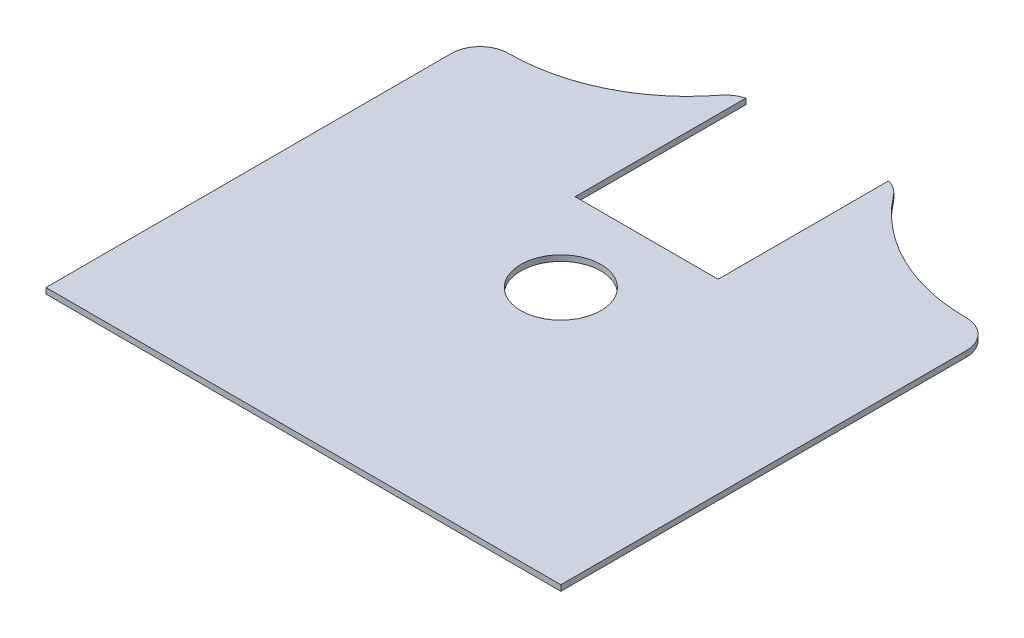
from build123d import *

# Parameters (mm, degrees)
SKETCH1_W           = 180
SKETCH1_H           = 180
BOSS_EXTRUDE1_DEPTH = 2
SKETCH2_R           = 14
CUT_EXTRUDE1_DEPTH  = 2
SKETCH4_W           = 50
SKETCH4_H           = 60
CUT_EXTRUDE2_DEPTH  = 2


with BuildPart() as part:
    # Sketch1 → Boss-Extrude1 (new body)
    with BuildSketch(Plane(origin=(0, 0, 0), x_dir=(1, 0, 0), z_dir=(0, 1, 0))):
        Rectangle(SKETCH1_W, SKETCH1_H)
    extrude(amount=BOSS_EXTRUDE1_DEPTH)

    # Sketch2 → Cut-Extrude1 (cut)
    with BuildSketch(Plane(origin=(0, 2, 0), x_dir=(-1, 0, 0), z_dir=(0, 1, 0))):
        Circle(SKETCH2_R)
        with BuildLine():
            Line((-22.28331281, -90), (-90, -90))
            Line((-90, -90), (-90, -51.741755227))
            ThreePointArc((-90, -51.741755227), (-87.062465996, -58.821414404), (-79.975685188, -61.741725666))
            ThreePointArc((-79.975685188, -61.741725666), (-52.247626752, -68.129791608), (-30.196860935, -86.113571466))
            ThreePointArc((-30.196860935, -86.113571466), (-26.691503217, -88.975959967), (-22.28331281, -90))
        make_face()
        with BuildLine():
            Line((90, -51.741726259), (90, -90))
            Line((90, -90), (22.435206222, -90))
            ThreePointArc((22.435206222, -90), (26.843382461, -88.975966926), (30.348735046, -86.11359645))
            ThreePointArc((30.348735046, -86.11359645), (52.340708927, -68.158736597), (79.996556017, -61.741725666))
            ThreePointArc((79.996556017, -61.741725666), (87.069850075, -58.814011598), (90, -51.741726259))
        make_face()
    extrude(amount=-CUT_EXTRUDE1_DEPTH, mode=Mode.SUBTRACT)

    # Sketch4 → Cut-Extrude2 (cut)
    with BuildSketch(Plane(origin=(0, 2, 0), x_dir=(1, 0, 0), z_dir=(0, 1, 0))):
        with Locations((0, 60)):
            Rectangle(SKETCH4_W, SKETCH4_H)
    extrude(amount=-CUT_EXTRUDE2_DEPTH, mode=Mode.SUBTRACT)


solid = part.part
